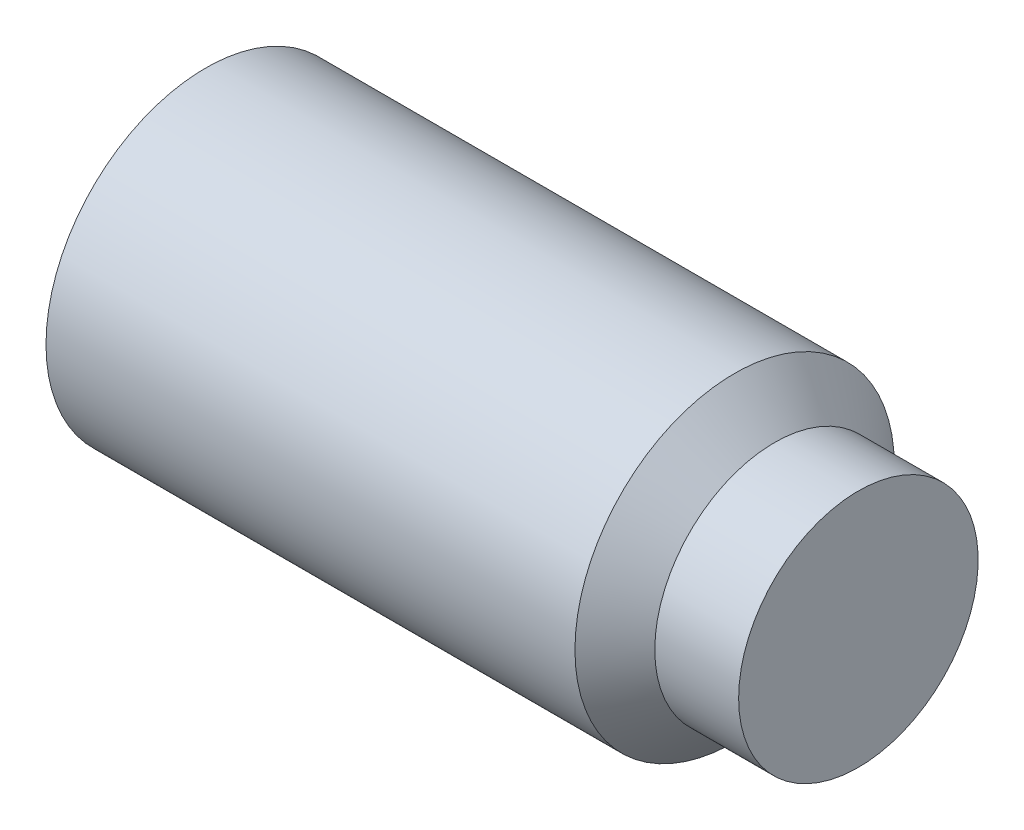
from build123d import *

# Parameters (mm, degrees)
HEX_2_DEPTH = 15


with BuildPart() as part:
    # BodySke → BaseBody (revolve)
    with BuildSketch(Plane.XY):
        Polygon((0, 0), (0, 10.352), (0.951473244, 12), (40.7, 12), (43.7, 9), (50, 9), (50, 0), align=None)
    revolve(axis=Axis((-12.7, 0, 0), (1, 0, 0)))

    # Sketch2 → Hex 2 (cut)
    with BuildSketch(Plane.ZY):
        Polygon((3.464101615, 6), (-3.464101615, 6), (-6.92820323, 0), (-3.464101615, -6), (3.464101615, -6), (6.92820323, 0), align=None)
    extrude(amount=-HEX_2_DEPTH, mode=Mode.SUBTRACT)


solid = part.part
